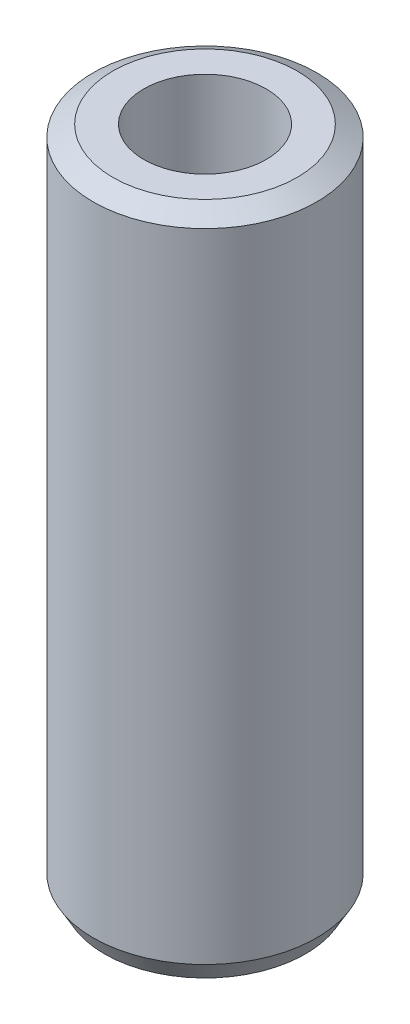
from build123d import *
from OCP.BRepFilletAPI import BRepFilletAPI_MakeChamfer

# Parameters (mm, degrees)
SKETCH1_R           = 57.5
BOSS_EXTRUDE1_DEPTH = 343.542344606
SKETCH2_R           = 31.474386452
CUT_EXTRUDE1_DEPTH  = 354.035185976
CHAMFER1_SIZE       = 5.83782636
CHAMFER1_SIZE2      = 10.111411861


with BuildPart() as part:
    # Sketch1 → Boss-Extrude1 (new body)
    with BuildSketch(Plane(origin=(0, 0, 0), x_dir=(1, 0, 0), z_dir=(0, 1, 0))):
        Circle(SKETCH1_R)
    extrude(amount=BOSS_EXTRUDE1_DEPTH)

    # Sketch2 → Cut-Extrude1 (cut, through all)
    with BuildSketch(Plane(origin=(0, 0, 0), x_dir=(1, 0, 0), z_dir=(0, 1, 0))):
        Circle(SKETCH2_R)
    extrude(amount=CUT_EXTRUDE1_DEPTH, mode=Mode.SUBTRACT)

    # Chamfer1: one chamfer whose edges measure the first distance from different faces: ONE call of the kernel's chamfer builder (chamfer() names one face for all edges)
    chamfer1_edges_1 = [part.edges().sort_by_distance(p)[0] for p in [
        (-57.5, 343.542344606, 0),
    ]]
    chamfer1_side_1 = [part.faces().sort_by_distance(p)[0] for p in [
        (-57.5, 171.771172303, 0),
    ]]
    chamfer1_edges_2 = [part.edges().sort_by_distance(p)[0] for p in [
        (-57.5, 0, 0),
    ]]
    chamfer1_side_2 = [part.faces().sort_by_distance(p)[0] for p in [
        (-55.873654403, 0, 0),
    ]]
    chamfer1 = BRepFilletAPI_MakeChamfer(part.part.solid().wrapped)
    for e in chamfer1_edges_1:
        chamfer1.Add(CHAMFER1_SIZE, CHAMFER1_SIZE2, e.wrapped, chamfer1_side_1[0].wrapped)  # the first distance lies on this face
    for e in chamfer1_edges_2:
        chamfer1.Add(CHAMFER1_SIZE, CHAMFER1_SIZE2, e.wrapped, chamfer1_side_2[0].wrapped)  # the first distance lies on this face
    add(Compound.cast(chamfer1.Shape()), mode=Mode.REPLACE)


solid = part.part
